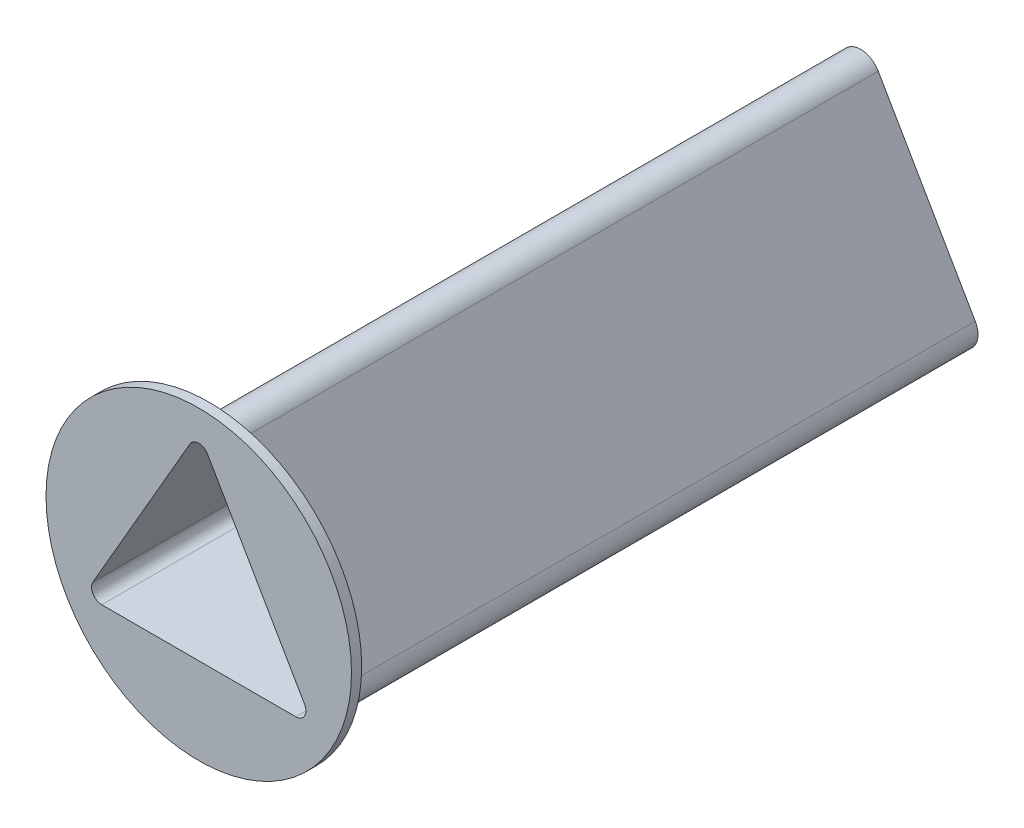
from build123d import *

# Parameters (mm, degrees)
BOSS_EXTRUDE1_DEPTH       = 65
FILLET1_R                 = 2
M4X0_7_TAPPED_HOLE1_D     = 3.3
M4X0_7_TAPPED_HOLE1_DEPTH = 13
M4X0_7_TAPPED_HOLE1_TIP   = 0.991420021
SKETCH5_R                 = 15
BOSS_EXTRUDE3_DEPTH       = 1
SHELL2_START              = 1
SHELL2_OUTLINE_R          = 2.65
SHELL2_DEPTH              = 64
SHELL2_START_2            = 15.158053519
SHELL2_2_OUTLINE_R        = 2.65
SHELL2_2_DEPTH            = 49.841946481


with BuildPart() as part:
    # Sketch1 → Boss-Extrude1 (new body)
    with BuildSketch(Plane.XY):
        Polygon((-12.990381057, -7.5), (12.990381057, -7.5), (0, 15), align=None)
    extrude(amount=BOSS_EXTRUDE1_DEPTH)

    # Fillet1
    fillet1_edges = [part.edges().sort_by_distance(p)[0] for p in [
        (-12.990381057, -7.5, 32.5),
        (0, 15, 32.5),
        (12.990381057, -7.5, 32.5),
    ]]
    fillet(fillet1_edges, radius=FILLET1_R)

    # M4x0.7 Tapped Hole1
    with Locations(Plane(origin=(0, 0, 0), x_dir=(-1, 0, 0), z_dir=(0, 0, -1))):
        with Locations((0, -3), (0, 7)):
            Hole(M4X0_7_TAPPED_HOLE1_D / 2, depth=M4X0_7_TAPPED_HOLE1_DEPTH)
            with Locations((0, 0, -(M4X0_7_TAPPED_HOLE1_DEPTH + M4X0_7_TAPPED_HOLE1_TIP / 2))):  # 118° drill point
                Cone(0, M4X0_7_TAPPED_HOLE1_D / 2, M4X0_7_TAPPED_HOLE1_TIP, mode=Mode.SUBTRACT)

    # Sketch5 → Boss-Extrude3 (add)
    with BuildSketch(Plane.XY.offset(65)):
        Circle(SKETCH5_R)
    extrude(amount=-BOSS_EXTRUDE3_DEPTH)

    # Shell2: read off the stored shape, not the designer's step
    # Shell2 outline → Shell2 (cut)
    with BuildSketch(Plane.XY.offset(SHELL2_START)):
        with BuildLine():
            Line((-9.526279442, -6.5), (9.526279442, -6.5))
            ThreePointArc((9.526279442, -6.5), (10.392304845, -6), (10.392304845, -5))
            Line((10.392304845, -5), (0.866025404, 11.5))
            ThreePointArc((0.866025404, 11.5), (0, 12), (-0.866025404, 11.5))
            Line((-0.866025404, 11.5), (-10.392304845, -5))
            ThreePointArc((-10.392304845, -5), (-10.392304845, -6), (-9.526279442, -6.5))
        make_face()
        with Locations((0, -3)):
            Circle(SHELL2_OUTLINE_R, mode=Mode.SUBTRACT)
        with Locations((0, 7)):
            Circle(SHELL2_OUTLINE_R, mode=Mode.SUBTRACT)
    extrude(amount=SHELL2_DEPTH, mode=Mode.SUBTRACT)

    # Shell2 2 outline → Shell2 2 (cut)
    with BuildSketch(Plane.XY.offset(SHELL2_START_2)):
        with Locations((0, 7)):
            Circle(SHELL2_2_OUTLINE_R)
        with Locations((0, -3)):
            Circle(SHELL2_2_OUTLINE_R)
    extrude(amount=SHELL2_2_DEPTH, mode=Mode.SUBTRACT)

    # Shell2 3 outline → Shell2 3 (revolve, cut)
    with BuildSketch(Plane.XZ.offset(-7)):
        Polygon((2.65, 15.158053519), (0, 15.158053519), (2.65, 13.565772778), align=None)
    revolve(axis=Axis((0, 7, 0), (0, 0, 1)), mode=Mode.SUBTRACT)

    # Shell2 4 outline → Shell2 4 (revolve, cut)
    with BuildSketch(Plane.XZ.offset(3)):
        Polygon((2.65, 15.158053519), (0, 15.158053519), (2.65, 13.565772778), align=None)
    revolve(axis=Axis((0, -3, 0), (0, 0, 1)), mode=Mode.SUBTRACT)


solid = part.part
